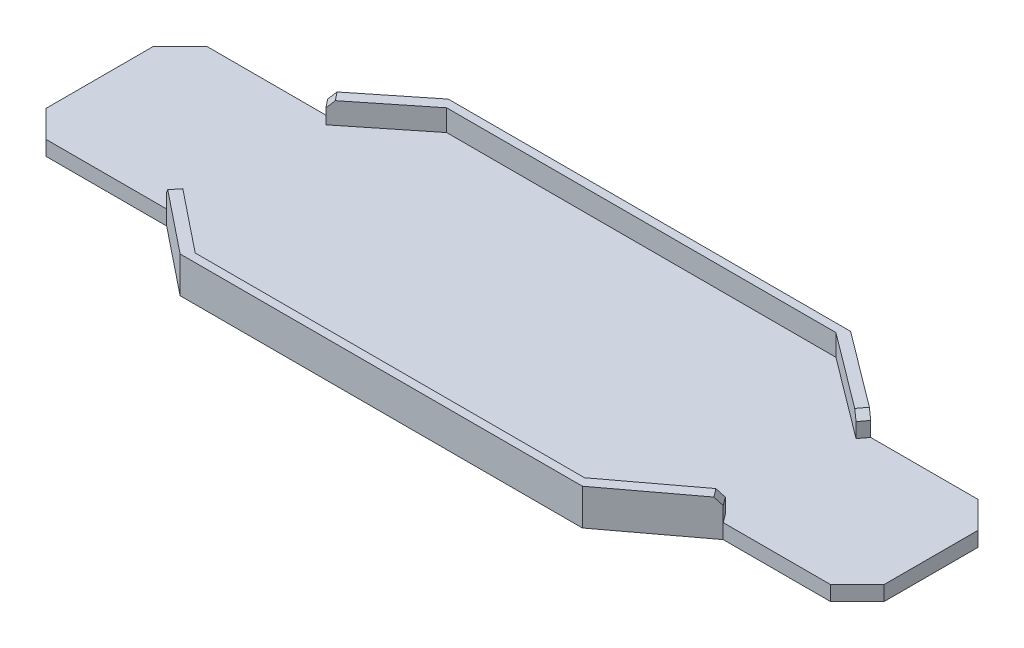
from build123d import *

# Parameters (mm, degrees)
BOSS_EXTRUDE1_DEPTH  = 5.5
CHASSIS_WALLS1_DEPTH = 8
CHAMFER1_SIZE        = 10
CHAMFER2_SIZE        = 10
CHAMFER3_SIZE        = 2.5


with BuildPart() as part:
    # Sketch1 → Boss-Extrude1 (new body)
    with BuildSketch(Plane(origin=(0, 0, 0), x_dir=(1, 0, 0), z_dir=(0, 1, 0))):
        Polygon((-100, 30), (-75, 50), (75, 50), (105, 27.5), (155, 27.5), (155, -27.5), (105, -27.5), (75, -50), (-75, -50), (-100, -30), (-155, -30), (-155, 30), align=None)
    extrude(amount=BOSS_EXTRUDE1_DEPTH)

    # Sketch3 → Chassis-Walls1 (add)
    with BuildSketch(Plane(origin=(0, 5.5, 0), x_dir=(1, 0, 0), z_dir=(0, 1, 0))):
        Polygon((0, 50), (-75, 50), (-100, 30), (-97.50121981, 26.876524762), (-72.50121981, 46.876524762), (0, 46.876524762), (72.657393572, 46.876524762), (102.657393572, 24.376524762), (105, 27.5), (75, 50), align=None)
        Polygon((72.657393572, -46.876524762), (0, -46.876524762), (-72.50121981, -46.876524762), (-97.50121981, -26.876524762), (-100, -30), (-75, -50), (0, -50), (75, -50), (105, -27.5), (102.657393572, -24.376524762), align=None)
    extrude(amount=CHASSIS_WALLS1_DEPTH)

    # Chamfer1
    chamfer1_edges = [part.edges().sort_by_distance(p)[0] for p in [
        (-155, 2.75, -30),
        (-155, 2.75, 30),
    ]]
    chamfer(chamfer1_edges, length=CHAMFER1_SIZE)

    # Chamfer2
    chamfer2_edges = [part.edges().sort_by_distance(p)[0] for p in [
        (155, 2.75, -27.5),
        (155, 2.75, 27.5),
    ]]
    chamfer(chamfer2_edges, length=CHAMFER2_SIZE)

    # Chamfer3
    chamfer3_edges = [part.edges().sort_by_distance(p)[0] for p in [
        (-98.750609905, 13.5, -28.438262381),
        (-98.750609905, 13.5, 28.438262381),
        (103.828696786, 13.5, 25.938262381),
        (103.828696786, 13.5, -25.938262381),
    ]]
    chamfer(chamfer3_edges, length=CHAMFER3_SIZE)


solid = part.part
